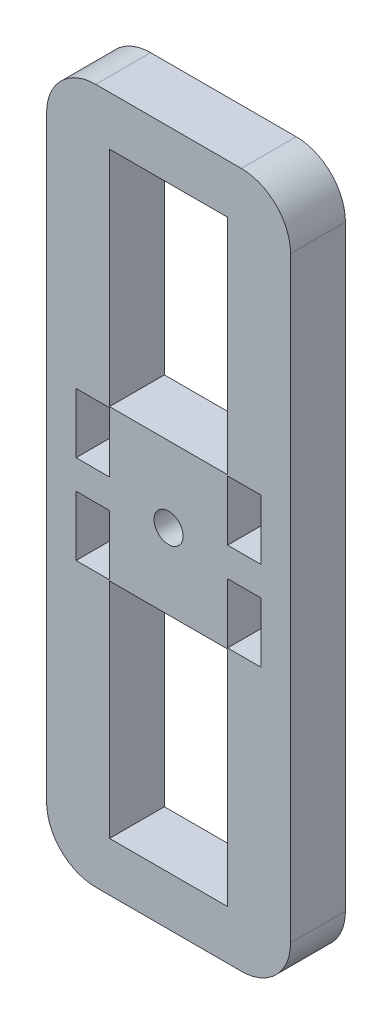
from build123d import *

# Parameters (mm, degrees)
SKETCH1_W           = 3.4
SKETCH1_H           = 6.1
SKETCH1_W_2         = 12
SKETCH1_H_2         = 22.669491249
SKETCH1_R           = 1.475
SKETCH1_H_3         = 22.669491248
BOSS_EXTRUDE1_DEPTH = 5.58


with BuildPart() as part:
    # Sketch1 → Boss-Extrude1 (new body)
    with BuildSketch(Plane.XY):
        with BuildLine():
            Line((708.295729089, 432.610180658), (715.695729089, 432.610180658))
            Line((715.695729089, 432.610180658), (723.095729089, 432.610180658))
            ThreePointArc((723.095729089, 432.610180658), (726.631262995, 434.074646752), (728.095729089, 437.610180658))
            Line((728.095729089, 437.610180658), (728.095729089, 498.299163155))
            ThreePointArc((728.095729089, 498.299163155), (726.631262995, 501.834697061), (723.095729089, 503.299163155))
            Line((723.095729089, 503.299163155), (715.695729089, 503.299163155))
            Line((715.695729089, 503.299163155), (708.295729089, 503.299163155))
            ThreePointArc((708.295729089, 503.299163155), (704.760195183, 501.834697061), (703.295729089, 498.299163155))
            Line((703.295729089, 498.299163155), (703.295729089, 437.610180658))
            ThreePointArc((703.295729089, 437.610180658), (704.760195183, 434.074646752), (708.295729089, 432.610180658))
        make_face()
        with Locations((707.995729089, 463.429671907)):
            Rectangle(SKETCH1_W, SKETCH1_H, mode=Mode.SUBTRACT)
        with Locations((715.695729089, 448.944926283)):
            Rectangle(SKETCH1_W_2, SKETCH1_H_2, mode=Mode.SUBTRACT)
        with Locations((715.695729089, 467.954671907)):
            Circle(SKETCH1_R, mode=Mode.SUBTRACT)
        with Locations((723.395729089, 463.429671907)):
            Rectangle(SKETCH1_W, SKETCH1_H, mode=Mode.SUBTRACT)
        with Locations((707.995729089, 472.479671907)):
            Rectangle(SKETCH1_W, SKETCH1_H, mode=Mode.SUBTRACT)
        with Locations((723.395729089, 472.479671907)):
            Rectangle(SKETCH1_W, SKETCH1_H, mode=Mode.SUBTRACT)
        with Locations((715.695729089, 486.964417531)):
            Rectangle(SKETCH1_W_2, SKETCH1_H_3, mode=Mode.SUBTRACT)
    extrude(amount=BOSS_EXTRUDE1_DEPTH)


solid = part.part
